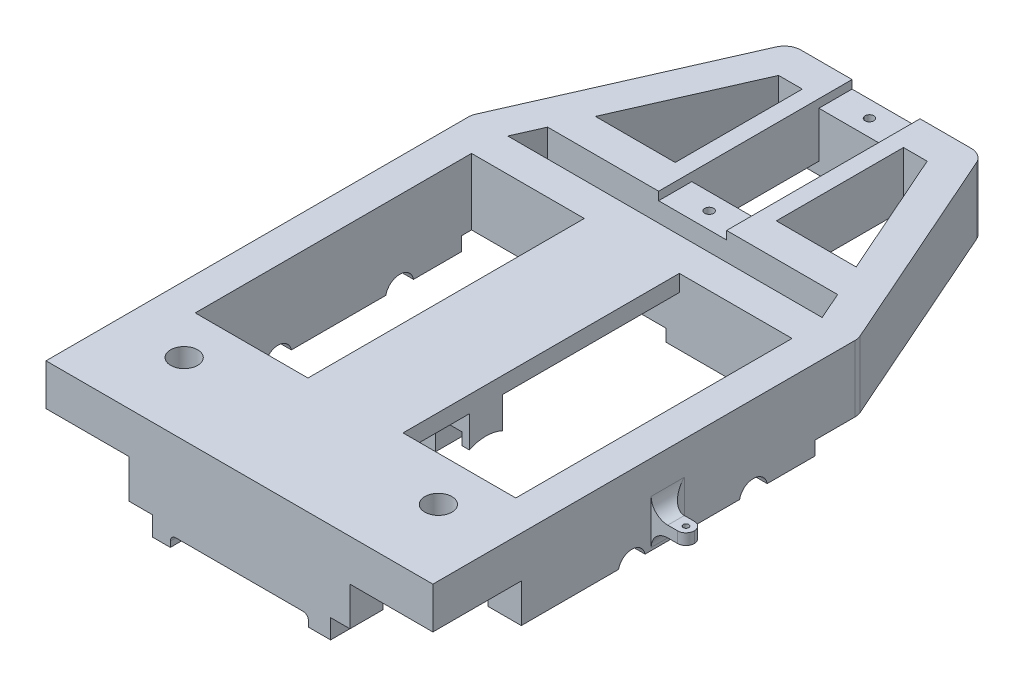
from build123d import *

# Parameters (mm, degrees)
SKETCH1_W               = 58
SKETCH1_H               = 65
BOSS_EXTRUDE1_DEPTH     = 30
BOSS_EXTRUDE3_REACH     = 92.09
SKETCH10_W              = 5
SKETCH10_H              = 6
CUT_EXTRUDE1_REACH      = 111.372
SKETCH2_R               = 2.45
SKETCH2_R_2             = 2.55
CUT_EXTRUDE2_REACH      = 91.744
SKETCH3_W               = 12.4
SKETCH3_H               = 10.4
SKETCH11_W              = 3
SKETCH11_H              = 2
BOSS_EXTRUDE4_DEPTH     = 6.3
FILLET3_R               = 1.5
SKETCH12_R              = 0.5
CUT_EXTRUDE3_DEPTH      = 92.15338732
FILLET3_OF_MIRROR1_R    = 1.5
BOSS_EXTRUDE5_REACH     = 111.564
SKETCH13_W              = 15
SKETCH13_H              = 6
BOSS_EXTRUDE6_REACH     = 111.564
SKETCH17_W              = 15
SKETCH17_H              = 14
SKETCH14_R              = 2.45
CUT_EXTRUDE4_DEPTH      = 94.637279017
SKETCH16_W              = 16
SKETCH16_H              = 7
CUT_EXTRUDE7_DEPTH      = 15
CUT_EXTRUDE8_REACH      = 129.651
CUT_EXTRUDE9_START      = -6
SKETCH19_W              = 30
SKETCH19_H              = 15
CUT_EXTRUDE9_DEPTH      = 18
CUT_EXTRUDE18_REACH     = 129.651
SKETCH35_W              = 16
SKETCH35_H              = 6
FILLET5_R               = 3
BOSS_EXTRUDE7_START     = 20.2
BOSS_EXTRUDE7_DEPTH     = 9.8
CUT_EXTRUDE12_REACH     = 109.009
CUT_EXTRUDE12_START     = 16.5
SKETCH23_W              = 12.3
SKETCH23_H              = 6
BOSS_EXTRUDE8_DEPTH     = 20
CUT_EXTRUDE15_REACH     = 95.168
SKETCH28_R              = 0.8
FILLET4_R               = 3
CUT_EXTRUDE16_REACH     = 96.767
SKETCH29_R              = 1.6
SKETCH30_W              = 6
SKETCH30_H              = 3.5
BOSS_EXTRUDE9_DEPTH     = 6.1
SKETCH31_W              = 1.3
SKETCH31_H              = 6
BOSS_EXTRUDE10_DEPTH    = 5
CUT_EXTRUDE17_REACH     = 99.736
MIRROR5_COPY_1_SKETCH_W = 6
MIRROR5_COPY_1_SKETCH_H = 3.5
MIRROR5_COPY_1_DEPTH    = 6.1
MIRROR5_COPY_2_SKETCH_W = 1.3
MIRROR5_COPY_2_SKETCH_H = 6
MIRROR5_COPY_2_DEPTH    = 5
MIRROR5_COPY_3_REACH    = 99.736
SKETCH36_W              = 117.647989829
SKETCH36_H              = 130.366691432
CUT_EXTRUDE19_DEPTH     = 12
SKETCH37_W              = 122.41750293
SKETCH37_H              = 135.772139613
SKETCH37_W_2            = 32.18776844
SKETCH37_H_2            = 6
CUT_EXTRUDE20_DEPTH     = 3.5
SKETCH38_W              = 70
SKETCH38_H              = 47.863029623
SKETCH38_W_2            = 5
SKETCH38_H_2            = 6
CUT_EXTRUDE21_DEPTH     = 2.5
SKETCH39_W              = 2.6
SKETCH39_H              = 2.8
CUT_EXTRUDE22_DEPTH     = 1.5


with BuildPart() as part:
    # Sketch1 → Boss-Extrude1 (new body)
    with BuildSketch(Plane(origin=(0, 0, 0), x_dir=(1, 0, 0), z_dir=(0, 1, 0))):
        Polygon((-35, 38.5), (-17.352941176, 78.5), (17.352941947, 78.5), (35, 38.5), (35, -38.5), (-35, -38.5), align=None)
        Rectangle(SKETCH1_W, SKETCH1_H, mode=Mode.SUBTRACT)
        Polygon((-28.44203382, 38.5), (28.442033867, 38.5), (13.442034522, 72.5), (-13.44203382, 72.5), align=None, mode=Mode.SUBTRACT)
    extrude(amount=BOSS_EXTRUDE1_DEPTH)

    # Sketch7 → Loft3 section 0
    with BuildSketch(Plane.XY.offset(-32.5)):
        with BuildLine():
            Line((-8.6, 30), (8.6, 30))
            Line((8.6, 30), (8.6, 27))
            Line((8.6, 27), (-8.6, 27))
            Line((-8.6, 27), (-8.6, 30))
        make_face()
    # Sketch8 → Loft3 section 1
    with BuildSketch(Plane.XY.offset(5.5)):
        with BuildLine():
            Line((-8.6, 30), (8.6, 30))
            Line((8.6, 30), (8.6, 27))
            Line((8.6, 27), (-8.6, 27))
            Line((-8.6, 27), (-8.6, 30))
        make_face()
    loft3 = loft()

    # Mirror3: Loft3 across plane
    add(loft3.mirror(Plane(origin=(0, 15, 0), x_dir=(0, 0, 1), z_dir=(0, -1, 0))))

    # Sketch10 → Boss-Extrude3 (add, up to next)
    with BuildSketch(Plane.XZ.offset(-27), mode=Mode.PRIVATE) as boss_extrude3_sk1:
        with Locations((0, 2.5)):
            Rectangle(SKETCH10_W, SKETCH10_H)
    boss_extrude3_tool1 = extrude(boss_extrude3_sk1.sketch, amount=BOSS_EXTRUDE3_REACH, mode=Mode.PRIVATE) - part.part
    add(boss_extrude3_tool1.solids().sort_by_distance((0, 27, 2.5))[0])

    # Sketch2 → Cut-Extrude1 (cut, up to next)
    with BuildSketch(Plane(origin=(35, 0, 0), x_dir=(0, 0, -1), z_dir=(1, 0, 0)), mode=Mode.PRIVATE) as cut_extrude1_sk1:
        with Locations((-2.5, 15)):
            Circle(SKETCH2_R)
    cut_extrude1_tool1 = extrude(cut_extrude1_sk1.sketch, amount=-CUT_EXTRUDE1_REACH, mode=Mode.PRIVATE) & part.part
    # Sketch2 → Cut-Extrude1 (cut, up to next)
    with BuildSketch(Plane(origin=(35, 0, 0), x_dir=(0, 0, -1), z_dir=(1, 0, 0)), mode=Mode.PRIVATE) as cut_extrude1_sk2:
        with Locations((19.5, 15)):
            Circle(SKETCH2_R_2)
    cut_extrude1_tool2 = extrude(cut_extrude1_sk2.sketch, amount=-CUT_EXTRUDE1_REACH, mode=Mode.PRIVATE) & part.part
    cut_extrude1_1 = cut_extrude1_tool1.solids().sort_by_distance((35, 15, 2.5))[0]
    add(cut_extrude1_1, mode=Mode.SUBTRACT)
    cut_extrude1_2 = cut_extrude1_tool2.solids().sort_by_distance((35, 15, -19.5))[0]
    add(cut_extrude1_2, mode=Mode.SUBTRACT)
    cut_extrude1 = cut_extrude1_1 + cut_extrude1_2  # Cut-Extrude1 as one shape, for the pattern or mirror that repeats it

    # Sketch3 → Cut-Extrude2 (cut, up to next)
    with BuildSketch(Plane(origin=(0, 0, -38.5), x_dir=(-1, 0, 0), z_dir=(0, 0, -1)), mode=Mode.PRIVATE) as cut_extrude2_sk1:
        with Locations((0, 15)):
            Rectangle(SKETCH3_W, SKETCH3_H)
    cut_extrude2_tool1 = extrude(cut_extrude2_sk1.sketch, amount=-CUT_EXTRUDE2_REACH, mode=Mode.PRIVATE) & part.part
    add(cut_extrude2_tool1.solids().sort_by_distance((0, 15, -38.5))[0], mode=Mode.SUBTRACT)

    # Sketch11 → Boss-Extrude4 (add)
    with BuildSketch(Plane(origin=(35, 0, 0), x_dir=(0, 0, -1), z_dir=(1, 0, 0))):
        with Locations((2.5, 20)):
            Rectangle(SKETCH11_W, SKETCH11_H)
        with Locations((2.5, 10)):
            Rectangle(SKETCH11_W, SKETCH11_H)
    boss_extrude4 = extrude(amount=BOSS_EXTRUDE4_DEPTH)

    # Fillet3
    fillet3_edges = [part.edges().sort_by_distance(p)[0] for p in [
        (41.3, 10, -1),
        (41.3, 10, -4),
        (41.3, 20, -1),
        (41.3, 20, -4),
    ]]
    fillet(fillet3_edges, radius=FILLET3_R - 0.0001)  # a hair under: the kernel refuses the full size

    # Sketch12 → Cut-Extrude3 (cut, through all)
    with BuildSketch(Plane(origin=(0, 21, 0), x_dir=(1, 0, 0), z_dir=(0, 1, 0))):
        with Locations(Location((39.8, 2.5, 0), (0, 0, 270))):
            Circle(SKETCH12_R)
    cut_extrude3 = extrude(amount=-CUT_EXTRUDE3_DEPTH, mode=Mode.SUBTRACT)

    # Mirror1: Cut-Extrude1, Boss-Extrude4, Cut-Extrude3 across plane
    add(cut_extrude1.mirror(Plane(origin=(0, 0, 0), x_dir=(0, 0, 1), z_dir=(1, 0, 0))), mode=Mode.SUBTRACT)
    add(boss_extrude4.mirror(Plane(origin=(0, 0, 0), x_dir=(0, 0, 1), z_dir=(1, 0, 0))))
    add(cut_extrude3.mirror(Plane(origin=(0, 0, 0), x_dir=(0, 0, 1), z_dir=(1, 0, 0))), mode=Mode.SUBTRACT)

    # Fillet3 of Mirror1
    fillet3_of_mirror1_edges = [part.edges().sort_by_distance(p)[0] for p in [
        (-41.3, 10, -1),
        (-41.3, 10, -4),
        (-41.3, 20, -1),
        (-41.3, 20, -4),
    ]]
    fillet(fillet3_of_mirror1_edges, radius=FILLET3_OF_MIRROR1_R - 0.0001)  # a hair under: the kernel refuses the full size

    # Sketch13 → Boss-Extrude5 (add, up to next)
    with BuildSketch(Plane(origin=(-29, 0, 0), x_dir=(0, 0, -1), z_dir=(1, 0, 0)), mode=Mode.PRIVATE) as boss_extrude5_sk1:
        with Locations((-25, 27)):
            Rectangle(SKETCH13_W, SKETCH13_H)
    boss_extrude5_tool1 = extrude(boss_extrude5_sk1.sketch, amount=BOSS_EXTRUDE5_REACH, mode=Mode.PRIVATE) - part.part
    add(boss_extrude5_tool1.solids().sort_by_distance((-29, 27, 25))[0])

    # Sketch17 → Boss-Extrude6 (add, up to next)
    with BuildSketch(Plane(origin=(-29, 0, 0), x_dir=(0, 0, -1), z_dir=(1, 0, 0)), mode=Mode.PRIVATE) as boss_extrude6_sk1:
        with Locations((-25, 7)):
            Rectangle(SKETCH17_W, SKETCH17_H)
    boss_extrude6_tool1 = extrude(boss_extrude6_sk1.sketch, amount=BOSS_EXTRUDE6_REACH, mode=Mode.PRIVATE) - part.part
    add(boss_extrude6_tool1.solids().sort_by_distance((-29, 7, 25))[0])

    # Sketch14 → Cut-Extrude4 (cut, through all)
    with BuildSketch(Plane(origin=(0, 30, 0), x_dir=(1, 0, 0), z_dir=(0, 1, 0))):
        with Locations(Location((-23, -25.5, 0), (0, 0, 270))):
            Circle(SKETCH14_R)
        with Locations(Location((23, -25.5, 0), (0, 0, 270))):
            Circle(SKETCH14_R)
    extrude(amount=-CUT_EXTRUDE4_DEPTH, mode=Mode.SUBTRACT)

    # Sketch16 → Cut-Extrude7 (cut)
    with BuildSketch(Plane(origin=(35, 0, 0), x_dir=(0, 0, -1), z_dir=(1, 0, 0))):
        with Locations((-30.5, 19)):
            Rectangle(SKETCH16_W, SKETCH16_H)
    cut_extrude7 = extrude(amount=-CUT_EXTRUDE7_DEPTH, mode=Mode.SUBTRACT)

    # Mirror2: Cut-Extrude7 across plane
    add(cut_extrude7.mirror(Plane(origin=(0, 0, 0), x_dir=(0, 0, 1), z_dir=(1, 0, 0))), mode=Mode.SUBTRACT)

    # Sketch18 → Cut-Extrude8 (cut, up to next)
    with BuildSketch(Plane.XY.offset(38.5), mode=Mode.PRIVATE) as cut_extrude8_sk1:
        with BuildLine():
            Line((-11.5, 14), (11.5, 14))
            ThreePointArc((11.5, 14), (12.207106781, 13.707106781), (12.5, 13))
            Line((12.5, 13), (12.5, 11))
            ThreePointArc((12.5, 11), (12.207106781, 10.292893219), (11.5, 10))
            Line((11.5, 10), (-11.5, 10))
            ThreePointArc((-11.5, 10), (-12.207106781, 10.292893219), (-12.5, 11))
            Line((-12.5, 11), (-12.5, 13))
            ThreePointArc((-12.5, 13), (-12.207106781, 13.707106781), (-11.5, 14))
        make_face()
    cut_extrude8_tool1 = extrude(cut_extrude8_sk1.sketch, amount=-CUT_EXTRUDE8_REACH, mode=Mode.PRIVATE) & part.part
    add(cut_extrude8_tool1.solids().sort_by_distance((0, 12, 38.5))[0], mode=Mode.SUBTRACT)

    # Sketch19 → Cut-Extrude9 (cut)
    with BuildSketch(Plane(origin=(0, 30, 0), x_dir=(1, 0, 0), z_dir=(0, 1, 0)).offset(CUT_EXTRUDE9_START)):
        with Locations((0, -25)):
            Rectangle(SKETCH19_W, SKETCH19_H)
    extrude(amount=-CUT_EXTRUDE9_DEPTH, mode=Mode.SUBTRACT)

    # Sketch35 → Cut-Extrude18 (cut, up to next)
    with BuildSketch(Plane(origin=(0, 0, -78.5), x_dir=(-1, 0, 0), z_dir=(0, 0, -1)), mode=Mode.PRIVATE) as cut_extrude18_sk1:
        with Locations((0, 15)):
            Rectangle(SKETCH35_W, SKETCH35_H)
    cut_extrude18_tool1 = extrude(cut_extrude18_sk1.sketch, amount=-CUT_EXTRUDE18_REACH, mode=Mode.PRIVATE) & part.part
    add(cut_extrude18_tool1.solids().sort_by_distance((0, 15, -78.5))[0], mode=Mode.SUBTRACT)

    # Fillet5
    fillet5_edges = [part.edges().sort_by_distance(p)[0] for p in [
        (-35, 15, -38.5),
        (-17.352941176, 15, -78.5),
        (17.352941947, 15, -78.5),
        (35, 15, -38.5),
        (-8, 15, -78.5),
        (8, 15, -78.5),
    ]]
    fillet(fillet5_edges, radius=FILLET5_R)

    # Sketch24 → Boss-Extrude7 (add)
    with BuildSketch(Plane(origin=(0, 0, 0), x_dir=(1, 0, 0), z_dir=(0, 1, 0)).offset(BOSS_EXTRUDE7_START)):
        Polygon((9.15, 49.5), (9.15, 72.5), (6.15, 72.5), (6.15, 49.5), (-6.15, 49.5), (-6.15, 72.5), (-9.15, 72.5), (-9.15, 49.5), (-23.589092644, 49.5), (-26.23615161, 43.5), (26.23615161, 43.5), (23.589092902, 49.5), align=None)
    extrude(amount=BOSS_EXTRUDE7_DEPTH)

    # Sketch23 → Cut-Extrude12 (cut, up to next)
    with BuildSketch(Plane(origin=(0, 12, 0), x_dir=(1, 0, 0), z_dir=(0, 1, 0)).offset(CUT_EXTRUDE12_START), mode=Mode.PRIVATE) as cut_extrude12_sk1:
        with Locations((0, 75.5)):
            Rectangle(SKETCH23_W, SKETCH23_H)
    cut_extrude12_tool1 = extrude(cut_extrude12_sk1.sketch, amount=CUT_EXTRUDE12_REACH, mode=Mode.PRIVATE) & part.part
    # Sketch23 → Cut-Extrude12 (cut, up to next)
    with BuildSketch(Plane(origin=(0, 12, 0), x_dir=(1, 0, 0), z_dir=(0, 1, 0)).offset(CUT_EXTRUDE12_START), mode=Mode.PRIVATE) as cut_extrude12_sk2:
        with Locations((0, 46.5)):
            Rectangle(SKETCH23_W, SKETCH23_H)
    cut_extrude12_tool2 = extrude(cut_extrude12_sk2.sketch, amount=CUT_EXTRUDE12_REACH, mode=Mode.PRIVATE) & part.part
    add(cut_extrude12_tool1.solids().sort_by_distance((0, 28.5, -75.5))[0], mode=Mode.SUBTRACT)
    add(cut_extrude12_tool2.solids().sort_by_distance((0, 28.5, -46.5))[0], mode=Mode.SUBTRACT)

    # Sketch26 → Boss-Extrude8 (add)
    with BuildSketch(Plane(origin=(0, 0, -38.5), x_dir=(-1, 0, 0), z_dir=(0, 0, -1))):
        Polygon((-6.2, 9.8), (6.2, 9.8), (6.2, 12), (11.2, 12), (11.2, 4.8), (-11.2, 4.8), (-11.2, 12), (-6.2, 12), align=None)
    extrude(amount=BOSS_EXTRUDE8_DEPTH)

    # Sketch28 → Cut-Extrude15 (cut, up to next)
    with BuildSketch(Plane(origin=(0, 28.5, 0), x_dir=(-1, 0, 0), z_dir=(0, 1, 0)), mode=Mode.PRIVATE) as cut_extrude15_sk1:
        with Locations(Location((0, -46.5, 0), (0, 0, 90))):
            Circle(SKETCH28_R)
    cut_extrude15_tool1 = extrude(cut_extrude15_sk1.sketch, amount=-CUT_EXTRUDE15_REACH, mode=Mode.PRIVATE) & part.part
    # Sketch28 → Cut-Extrude15 (cut, up to next)
    with BuildSketch(Plane(origin=(0, 28.5, 0), x_dir=(-1, 0, 0), z_dir=(0, 1, 0)), mode=Mode.PRIVATE) as cut_extrude15_sk2:
        with Locations(Location((0, -75.5, 0), (0, 0, 90))):
            Circle(SKETCH28_R)
    cut_extrude15_tool2 = extrude(cut_extrude15_sk2.sketch, amount=-CUT_EXTRUDE15_REACH, mode=Mode.PRIVATE) & part.part
    add(cut_extrude15_tool1.solids().sort_by_distance((0, 28.5, -46.5))[0], mode=Mode.SUBTRACT)
    add(cut_extrude15_tool2.solids().sort_by_distance((0, 28.5, -75.5))[0], mode=Mode.SUBTRACT)

    # Fillet4
    fillet4_edges = [part.edges().sort_by_distance(p)[0] for p in [
        (35, 19, -2.5),
        (35, 20, -4),
        (35, 21, -2.5),
        (35, 11, -2.5),
        (35, 9, -2.5),
        (35, 10, -4),
        (-35, 19, -2.5),
        (-35, 20, -4),
        (-35, 21, -2.5),
        (-35, 11, -2.5),
        (-35, 9, -2.5),
        (-35, 10, -4),
    ]]
    fillet(fillet4_edges, radius=FILLET4_R)

    # Sketch29 → Cut-Extrude16 (cut, up to next)
    with BuildSketch(Plane(origin=(2.5, 0, 0), x_dir=(0, 0, -1), z_dir=(1, 0, 0)), mode=Mode.PRIVATE) as cut_extrude16_sk1:
        with Locations(Location((-2.5, 15, 0), (0, 0, 90))):
            Circle(SKETCH29_R)
    cut_extrude16_tool1 = extrude(cut_extrude16_sk1.sketch, amount=-CUT_EXTRUDE16_REACH, mode=Mode.PRIVATE) & part.part
    add(cut_extrude16_tool1.solids().sort_by_distance((2.5, 15, 2.5))[0], mode=Mode.SUBTRACT)

    # Sketch30 → Boss-Extrude9 (add)
    with BuildSketch(Plane.ZY.offset(2.5)):
        with Locations((2.5, 25.25)):
            Rectangle(SKETCH30_W, SKETCH30_H)
    boss_extrude9 = extrude(amount=BOSS_EXTRUDE9_DEPTH)

    # Sketch31 → Boss-Extrude10 (add)
    with BuildSketch(Plane.XZ.offset(-23.5)):
        with Locations((-7.95, 2.5)):
            Rectangle(SKETCH31_W, SKETCH31_H)
    boss_extrude10 = extrude(amount=BOSS_EXTRUDE10_DEPTH)

    # Sketch32 → Cut-Extrude17 (cut, up to next)
    with BuildSketch(Plane.ZY.offset(8.6), mode=Mode.PRIVATE) as cut_extrude17_sk1:
        with BuildLine():
            Line((-0.5, 18.5), (-0.5, 21.32455532))
            ThreePointArc((-0.5, 21.32455532), (2.5, 22), (5.5, 21.32455532))
            Line((5.5, 21.32455532), (5.5, 18.5))
            Line((5.5, 18.5), (-0.5, 18.5))
        make_face()
    cut_extrude17_tool1 = extrude(cut_extrude17_sk1.sketch, amount=-CUT_EXTRUDE17_REACH, mode=Mode.PRIVATE) & part.part
    cut_extrude17 = cut_extrude17_tool1.solids().sort_by_distance((-8.6, 20.145783, 2.5))[0]
    add(cut_extrude17, mode=Mode.SUBTRACT)

    # Mirror4: Boss-Extrude9, Boss-Extrude10, Cut-Extrude17 across plane
    add(boss_extrude9.mirror(Plane(origin=(0, 15, 0), x_dir=(0, 0, 1), z_dir=(0, -1, 0))))
    add(boss_extrude10.mirror(Plane(origin=(0, 15, 0), x_dir=(0, 0, 1), z_dir=(0, -1, 0))))
    add(cut_extrude17.mirror(Plane(origin=(0, 15, 0), x_dir=(0, 0, 1), z_dir=(0, -1, 0))), mode=Mode.SUBTRACT)

    # Mirror5: Boss-Extrude9, Boss-Extrude10, Cut-Extrude17 across plane
    add(boss_extrude9.mirror(Plane(origin=(0, 0, 0), x_dir=(0, 0, 1), z_dir=(1, 0, 0))))
    add(boss_extrude10.mirror(Plane(origin=(0, 0, 0), x_dir=(0, 0, 1), z_dir=(1, 0, 0))))
    add(cut_extrude17.mirror(Plane(origin=(0, 0, 0), x_dir=(0, 0, 1), z_dir=(1, 0, 0))), mode=Mode.SUBTRACT)

    # Mirror5 copy 1 sketch → Mirror5 copy 1 (add)
    with BuildSketch(Plane(origin=(2.5, 30, 0), x_dir=(0, 0, 1), z_dir=(1, 0, 0))):
        with Locations((2.5, 25.25)):
            Rectangle(MIRROR5_COPY_1_SKETCH_W, MIRROR5_COPY_1_SKETCH_H)
    extrude(amount=MIRROR5_COPY_1_DEPTH)

    # Mirror5 copy 2 sketch → Mirror5 copy 2 (add)
    with BuildSketch(Plane(origin=(0, 6.5, 0), x_dir=(-1, 0, 0), z_dir=(0, 1, 0))):
        with Locations((-7.95, 2.5)):
            Rectangle(MIRROR5_COPY_2_SKETCH_W, MIRROR5_COPY_2_SKETCH_H)
    extrude(amount=MIRROR5_COPY_2_DEPTH)

    # Mirror5 copy 3 sketch → Mirror5 copy 3 (cut, up to next)
    with BuildSketch(Plane(origin=(8.6, 30, 0), x_dir=(0, 0, 1), z_dir=(1, 0, 0)), mode=Mode.PRIVATE) as mirror5_copy_3_sk1:
        with BuildLine():
            Line((-0.5, 18.5), (-0.5, 21.32455532))
            ThreePointArc((-0.5, 21.32455532), (2.5, 22), (5.5, 21.32455532))
            Line((5.5, 21.32455532), (5.5, 18.5))
            Line((5.5, 18.5), (-0.5, 18.5))
        make_face()
    mirror5_copy_3_tool1 = extrude(mirror5_copy_3_sk1.sketch, amount=-MIRROR5_COPY_3_REACH, mode=Mode.PRIVATE) & part.part
    add(mirror5_copy_3_tool1.solids().sort_by_distance((8.6, 9.854217, 2.5))[0], mode=Mode.SUBTRACT)

    # Sketch33 → Loft4 section 0
    with BuildSketch(Plane.XY.offset(5.5)):
        with BuildLine():
            Line((-8.6, 30), (8.6, 30))
            Line((8.6, 30), (8.6, 27))
            Line((8.6, 27), (-8.6, 27))
            Line((-8.6, 27), (-8.6, 30))
        make_face()
    # Sketch34 → Loft4 section 1
    with BuildSketch(Plane(origin=(0, 0, 17.5), x_dir=(-1, 0, 0), z_dir=(0, 0, -1))):
        with BuildLine():
            Line((-8.6, 30), (8.6, 30))
            Line((8.6, 30), (8.6, 27))
            Line((8.6, 27), (-8.6, 27))
            Line((-8.6, 27), (-8.6, 30))
        make_face()
    loft4 = loft()

    # Mirror6: Loft4 across plane
    add(loft4.mirror(Plane(origin=(0, 15, 0), x_dir=(0, 0, 1), z_dir=(0, -1, 0))))

    # Sketch36 → Cut-Extrude19 (cut)
    with BuildSketch(Plane.XZ):
        with Locations((-2.588647032, -14.890240884)):
            Rectangle(SKETCH36_W, SKETCH36_H)
    extrude(amount=-CUT_EXTRUDE19_DEPTH, mode=Mode.SUBTRACT)

    # Sketch37 → Cut-Extrude20 (cut)
    with BuildSketch(Plane.XZ.offset(-12)):
        with Locations((9.01716818, -22.362478076)):
            Rectangle(SKETCH37_W, SKETCH37_H)
        with Locations((0.398006196, 35.5)):
            Rectangle(SKETCH37_W_2, SKETCH37_H_2, mode=Mode.SUBTRACT)
    extrude(amount=-CUT_EXTRUDE20_DEPTH, mode=Mode.SUBTRACT)

    # Sketch38 → Cut-Extrude21 (cut)
    with BuildSketch(Plane.XZ.offset(-15.5)):
        with Locations((0, -54.568485188)):
            Rectangle(SKETCH38_W, SKETCH38_H)
        with Locations((0, 2.5)):
            Rectangle(SKETCH38_W_2, SKETCH38_H_2)
    extrude(amount=-CUT_EXTRUDE21_DEPTH, mode=Mode.SUBTRACT)

    # Sketch39 → Cut-Extrude22 (cut)
    with BuildSketch(Plane.XZ.offset(-18)):
        with Locations((0, 2.5)):
            Rectangle(SKETCH39_W, SKETCH39_H)
    extrude(amount=-CUT_EXTRUDE22_DEPTH, mode=Mode.SUBTRACT)


solid = part.part
